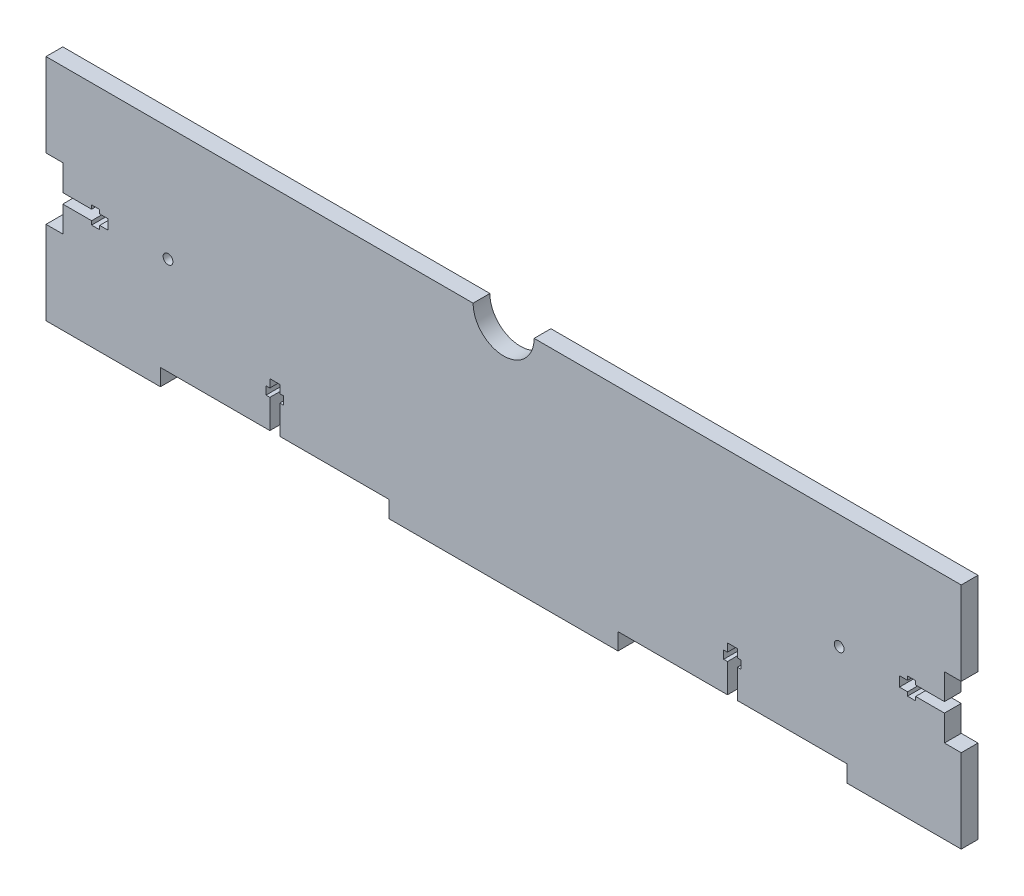
from build123d import *

# Parameters (mm, degrees)
BOSS_EXTRUDE1_DEPTH = 5.5
SKETCH2_R           = 10
CUT_EXTRUDE2_DEPTH  = 311.022983019
SKETCH3_R           = 1.6
CUT_EXTRUDE3_DEPTH  = 311.022983019


with BuildPart() as part:
    # Sketch1 → Boss-Extrude1 (new body)
    with BuildSketch(Plane.XY):
        Polygon((0, 78), (0, 50.625), (5.5, 50.625), (5.5, 42.125), (14.95, 42.125), (14.95, 43.375), (17.6, 43.375), (17.6, 42.125), (20.25, 42.125), (20.25, 38.875), (17.6, 38.875), (17.6, 37.625), (14.95, 37.625), (14.95, 38.875), (5.5, 38.875), (5.5, 30.375), (0, 30.375), (0, 3), (37.5, 3), (37.5, 8.5), (73.375, 8.5), (73.375, 17.95), (72.125, 17.95), (72.125, 20.6), (73.375, 20.6), (73.375, 23.25), (76.625, 23.25), (76.625, 20.6), (77.875, 20.6), (77.875, 17.95), (76.625, 17.95), (76.625, 8.5), (112.5, 8.5), (112.5, 3), (187.5, 3), (187.5, 8.5), (223.375, 8.5), (223.375, 17.95), (222.125, 17.95), (222.125, 20.6), (223.375, 20.6), (223.375, 23.25), (226.625, 23.25), (226.625, 20.6), (227.875, 20.6), (227.875, 17.95), (226.625, 17.95), (226.625, 8.5), (262.5, 8.5), (262.5, 3), (300, 3), (300, 30.375), (294.5, 30.375), (294.5, 38.875), (285.05, 38.875), (285.05, 37.625), (282.4, 37.625), (282.4, 38.875), (279.75, 38.875), (279.75, 42.125), (282.4, 42.125), (282.4, 43.375), (285.05, 43.375), (285.05, 42.125), (294.5, 42.125), (294.5, 50.625), (300, 50.625), (300, 78), align=None)
    extrude(amount=BOSS_EXTRUDE1_DEPTH)

    # Sketch2 → Cut-Extrude2 (cut, through all)
    with BuildSketch(Plane.XY):
        with Locations((150, 78)):
            Circle(SKETCH2_R)
    extrude(amount=CUT_EXTRUDE2_DEPTH, mode=Mode.SUBTRACT)

    # Sketch3 → Cut-Extrude3 (cut, through all)
    with BuildSketch(Plane.XY.offset(5.5)):
        with Locations((40, 40.5)):
            Circle(SKETCH3_R)
        with Locations((260, 40.5)):
            Circle(SKETCH3_R)
    extrude(amount=-CUT_EXTRUDE3_DEPTH, mode=Mode.SUBTRACT)


solid = part.part
